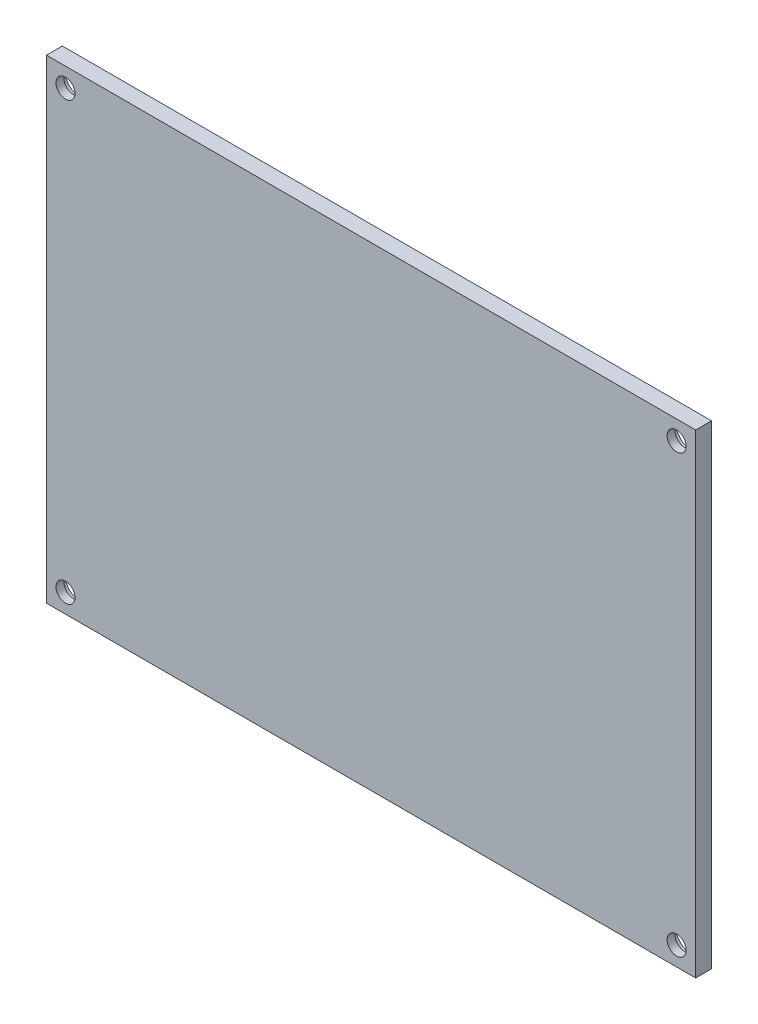
from build123d import *

# Parameters (mm, degrees)
SKETCH1_W                                        = 81.8
SKETCH1_H                                        = 59.8
BOSS_EXTRUDE1_DEPTH                              = 2
CBORE_FOR_M2_PAN_HEAD_MACHINE_SCREW1_D           = 2.4
CBORE_FOR_M2_PAN_HEAD_MACHINE_SCREW1_DEPTH       = 6
CBORE_FOR_M2_PAN_HEAD_MACHINE_SCREW1_CBORE_D     = 4.25
CBORE_FOR_M2_PAN_HEAD_MACHINE_SCREW1_CBORE_DEPTH = 1
CBORE_FOR_M2_PAN_HEAD_MACHINE_SCREW1_TIP         = 0.721032743


with BuildPart() as part:
    # Sketch1 → Boss-Extrude1 (new body)
    with BuildSketch(Plane.XY):
        with Locations((95.591153219, 2.636127214)):
            Rectangle(SKETCH1_W, SKETCH1_H)
    extrude(amount=BOSS_EXTRUDE1_DEPTH)

    # CBORE for M2 Pan Head Machine Screw1
    with Locations(Plane(origin=(0, 0, 0), x_dir=(-1, 0, 0), z_dir=(0, 0, -1))):
        with Locations((-134.091153219, 30.136127214), (-57.091153219, 30.136127214), (-57.091153219, -24.863872786), (-134.091153219, -24.863872786)):
            CounterBoreHole(CBORE_FOR_M2_PAN_HEAD_MACHINE_SCREW1_D / 2, CBORE_FOR_M2_PAN_HEAD_MACHINE_SCREW1_CBORE_D / 2, CBORE_FOR_M2_PAN_HEAD_MACHINE_SCREW1_CBORE_DEPTH, depth=CBORE_FOR_M2_PAN_HEAD_MACHINE_SCREW1_DEPTH)
            with Locations((0, 0, -(CBORE_FOR_M2_PAN_HEAD_MACHINE_SCREW1_DEPTH + CBORE_FOR_M2_PAN_HEAD_MACHINE_SCREW1_TIP / 2))):  # 118° drill point
                Cone(0, CBORE_FOR_M2_PAN_HEAD_MACHINE_SCREW1_D / 2, CBORE_FOR_M2_PAN_HEAD_MACHINE_SCREW1_TIP, mode=Mode.SUBTRACT)


solid = part.part
